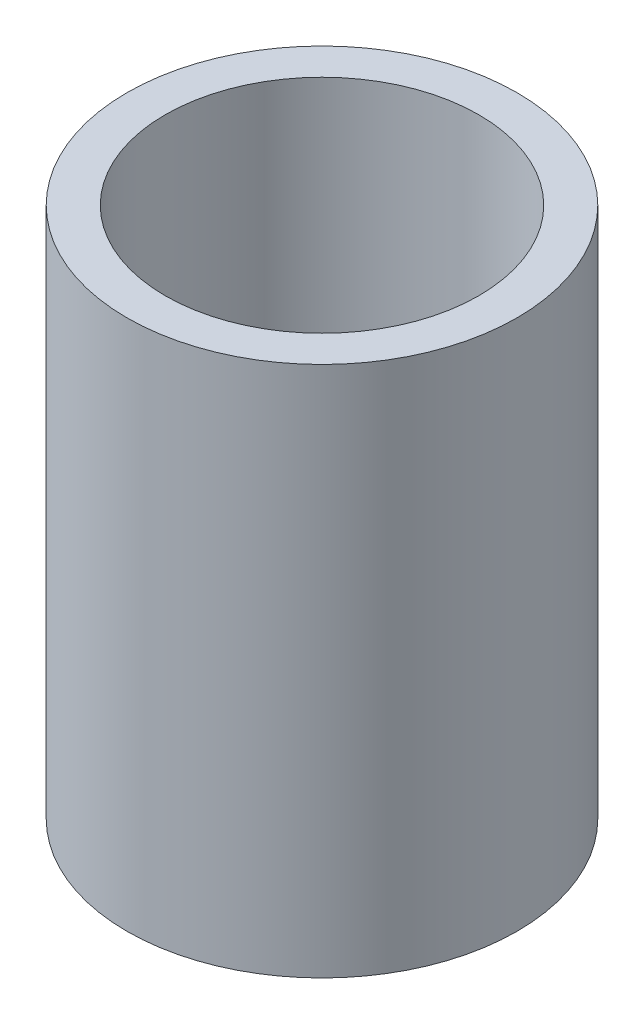
from build123d import *

# Parameters (mm, degrees)
SKETCH1_R           = 6.35
SKETCH1_R_2         = 5.1054
BOSS_EXTRUDE1_DEPTH = 17.3


with BuildPart() as part:
    # Sketch1 → Boss-Extrude1 (new body)
    with BuildSketch(Plane(origin=(0, 0, 0), x_dir=(1, 0, 0), z_dir=(0, 1, 0))):
        Circle(SKETCH1_R)
        Circle(SKETCH1_R_2, mode=Mode.SUBTRACT)
    extrude(amount=BOSS_EXTRUDE1_DEPTH)


solid = part.part
